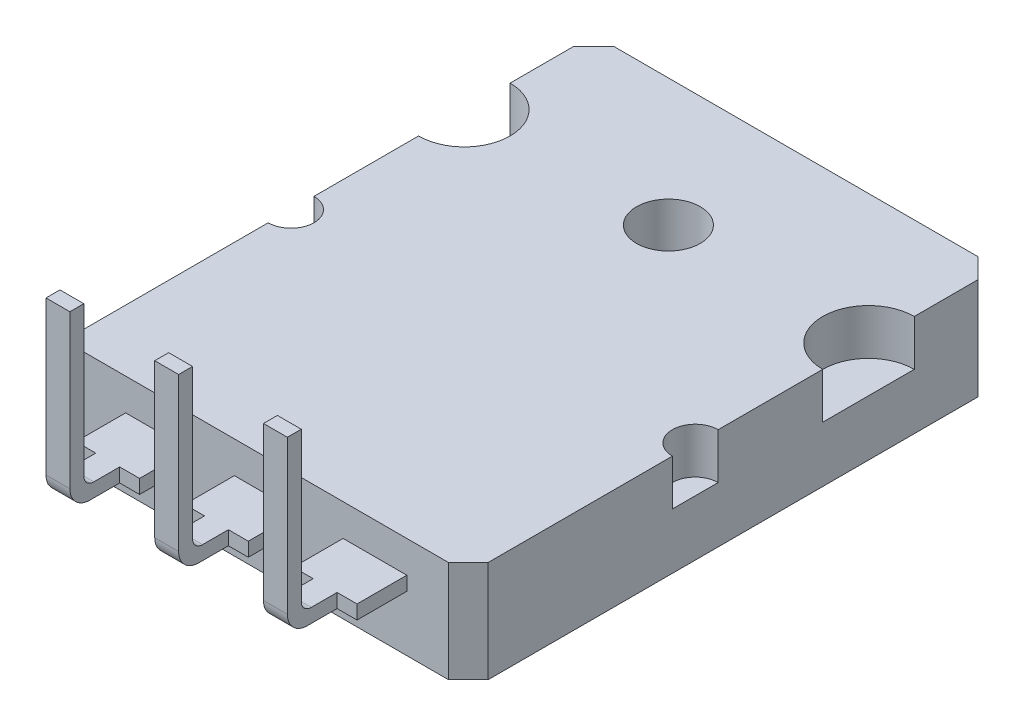
from build123d import *

# Parameters (mm, degrees)
SKETCH_1_R      = 1.6
EXTRUDE_1_DEPTH = 2.8
EXTRUDE_START   = 2.3
SKETCH_1_3_R    = 1.6
EXTRUDE_2_DEPTH = 2.3
EXTRUDE_3_DEPTH = 0.7
SKETCH_2_W      = 1.2
SKETCH_2_H      = 0.7
EXTRUDE_4_DEPTH = 8
FILLET_1_R      = 0.5
FILLET_2_R      = 1


with BuildPart() as part:
    # Эскиз1 → Бобышка-Вытянуть1 (new body)
    with BuildSketch(Plane(origin=(0, 0, 0), x_dir=(1, 0, 0), z_dir=(0, 1, 0))):
        Polygon((9.15, -13.3), (10.15, -12.3), (10.15, 12.3), (9.15, 13.3), (-9.15, 13.3), (-10.15, 12.3), (-10.15, -12.3), (-9.15, -13.3), align=None)
        with Locations((0, 6.9)):
            Circle(SKETCH_1_R, mode=Mode.SUBTRACT)
    extrude(amount=-EXTRUDE_1_DEPTH)

    # Эскиз1<3> → Бобышка-Вытянуть2 (add)
    with BuildSketch(Plane(origin=(0, 0, 0), x_dir=(1, 0, 0), z_dir=(0, 1, 0)).offset(EXTRUDE_START)):
        with BuildLine():
            Line((9.15, -13.3), (10.15, -12.3))
            Line((10.15, -12.3), (10.15, -3.05))
            ThreePointArc((10.15, -3.05), (9, -1.9), (10.15, -0.75))
            Line((10.15, -0.75), (10.15, 4.5))
            ThreePointArc((10.15, 4.5), (7.85, 6.8), (10.15, 9.1))
            Line((10.15, 9.1), (10.15, 12.3))
            Line((10.15, 12.3), (9.15, 13.3))
            Line((9.15, 13.3), (-9.15, 13.3))
            Line((-9.15, 13.3), (-10.15, 12.3))
            Line((-10.15, 12.3), (-10.15, 9.1))
            ThreePointArc((-10.15, 9.1), (-7.85, 6.8), (-10.15, 4.5))
            Line((-10.15, 4.5), (-10.15, -0.75))
            ThreePointArc((-10.15, -0.75), (-9, -1.9), (-10.15, -3.05))
            Line((-10.15, -3.05), (-10.15, -12.3))
            Line((-10.15, -12.3), (-9.15, -13.3))
            Line((-9.15, -13.3), (9.15, -13.3))
        make_face()
        with Locations((0, 6.9)):
            Circle(SKETCH_1_3_R, mode=Mode.SUBTRACT)
    extrude(amount=-EXTRUDE_2_DEPTH)

    # Эскиз1<4> → Бобышка-Вытянуть3 (add)
    with BuildSketch(Plane(origin=(0, 0, 0), x_dir=(1, 0, 0), z_dir=(0, 1, 0))):
        Polygon((7.061, -15.8), (7.061, -13.3), (3.861, -13.3), (3.861, -15.8), (4.861, -15.8), (4.861, -18.3), (6.061, -18.3), (6.061, -15.8), align=None)
        Polygon((1.6, -15.8), (1.6, -13.3), (-1.6, -13.3), (-1.6, -15.8), (-0.6, -15.8), (-0.6, -18.3), (0.6, -18.3), (0.6, -15.8), align=None)
        Polygon((-3.861, -15.8), (-3.861, -13.3), (-7.061, -13.3), (-7.061, -15.8), (-6.061, -15.8), (-6.061, -18.3), (-4.861, -18.3), (-4.861, -15.8), align=None)
    extrude(amount=EXTRUDE_3_DEPTH)

    # Эскиз2 → Бобышка-Вытянуть4 (add)
    with BuildSketch(Plane(origin=(0, 0.7, 0), x_dir=(1, 0, 0), z_dir=(0, 1, 0))):
        with Locations((-5.461, -17.95)):
            Rectangle(SKETCH_2_W, SKETCH_2_H)
        with Locations((0, -17.95)):
            Rectangle(SKETCH_2_W, SKETCH_2_H)
        with Locations((5.461, -17.95)):
            Rectangle(SKETCH_2_W, SKETCH_2_H)
    extrude(amount=EXTRUDE_4_DEPTH)

    # Скругление1
    fillet_1_edges = [part.edges().sort_by_distance(p)[0] for p in [
        (-5.461, 0.7, 17.6),
        (0, 0.7, 17.6),
        (5.461, 0.7, 17.6),
    ]]
    fillet(fillet_1_edges, radius=FILLET_1_R)

    # Скругление2
    fillet_2_edges = [part.edges().sort_by_distance(p)[0] for p in [
        (-5.461, 0, 18.3),
        (0, 0, 18.3),
        (5.461, 0, 18.3),
    ]]
    fillet(fillet_2_edges, radius=FILLET_2_R)


solid = part.part
